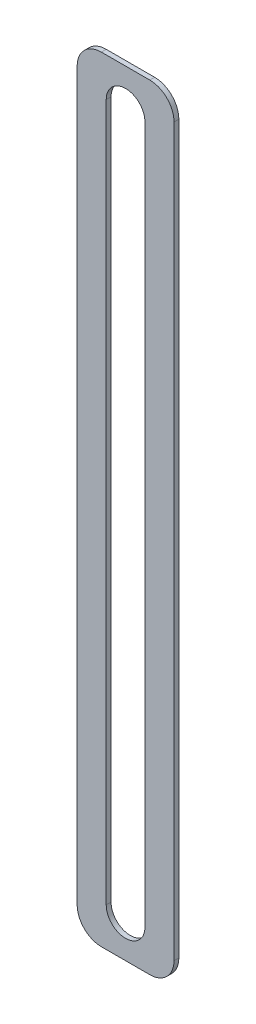
from build123d import *

# Parameters (mm, degrees)
EXTRUDE_1_DEPTH = 0.5


with BuildPart() as part:
    # 草圖2 → 填料-伸長1 (new body)
    with BuildSketch(Plane.XY):
        with BuildLine():
            Line((2.5, 40), (-2.5, 40))
            ThreePointArc((-2.5, 40), (-4.267766953, 39.267766953), (-5, 37.5))
            Line((-5, 37.5), (-5, -37.5))
            ThreePointArc((-5, -37.5), (-4.267766953, -39.267766953), (-2.5, -40))
            Line((-2.5, -40), (2.5, -40))
            ThreePointArc((2.5, -40), (4.267766953, -39.267766953), (5, -37.5))
            Line((5, -37.5), (5, 37.5))
            ThreePointArc((5, 37.5), (4.267766953, 39.267766953), (2.5, 40))
        make_face()
        with BuildLine():
            Line((-2, -36), (-2, 36))
            ThreePointArc((-2, 36), (0, 38), (2, 36))
            Line((2, 36), (2, -36))
            ThreePointArc((2, -36), (0, -38), (-2, -36))
        make_face(mode=Mode.SUBTRACT)
    extrude(amount=EXTRUDE_1_DEPTH)


solid = part.part
